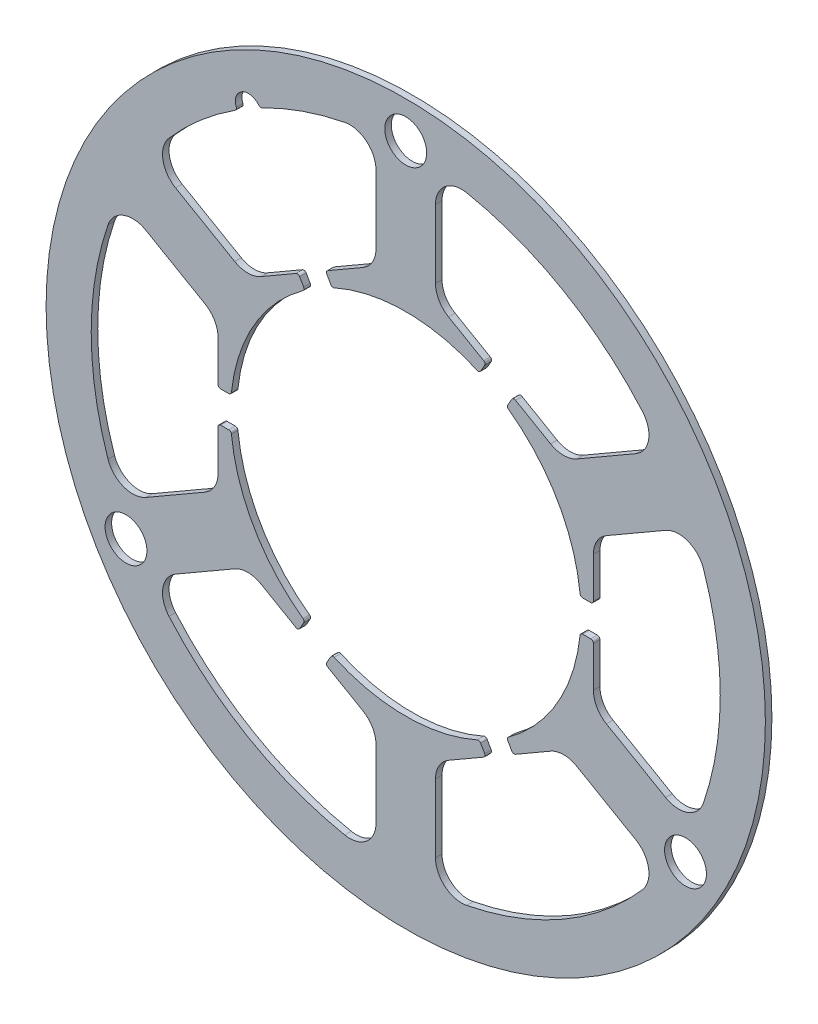
from build123d import *

# Parameters (mm, degrees)
IZIM1_R                     = 27.5
IZIM1_R_2                   = 1.6
Y_KSEKLIK_EKSTR_ZYON1_DEPTH = 0.5


with BuildPart() as part:
    # Çizim1 → Yükseklik-Ekstrüzyon1 (new body)
    with BuildSketch(Plane.XY):
        Circle(IZIM1_R)
        with Locations((0, 24.7)):
            Circle(IZIM1_R_2, mode=Mode.SUBTRACT)
        with Locations((21.390827473, -12.35)):
            Circle(IZIM1_R_2, mode=Mode.SUBTRACT)
        with Locations((-21.390827473, -12.35)):
            Circle(IZIM1_R_2, mode=Mode.SUBTRACT)
        with BuildLine():
            Line((5.962544219, 13.127476216), (3.275, 14.679130594))
            ThreePointArc((3.275, 14.679130594), (2.542949192, 15.411181402), (2.275, 16.411181402))
            Line((2.275, 16.411181402), (2.275, 21.631617485))
            ThreePointArc((2.275, 21.631617485), (3.00525794, 23.176853746), (4.662755102, 23.593668957))
            ThreePointArc((4.662755102, 23.593668957), (12.025, 20.827910961), (18.101339134, 15.834898849))
            ThreePointArc((18.101339134, 15.834898849), (18.569115153, 14.191056594), (17.596030267, 12.786016536))
            Line((17.596030267, 12.786016536), (13.075, 10.175798494))
            ThreePointArc((13.075, 10.175798494), (12.075, 9.907849302), (11.075, 10.175798494))
            Line((11.075, 10.175798494), (8.387415349, 11.727476216))
            ThreePointArc((8.387415349, 11.727476216), (8.23565154, 11.747456301), (8.114210268, 11.654271135))
            Line((8.114210268, 11.654271135), (7.803086106, 11.115388278))
            ThreePointArc((7.803086106, 11.115388278), (7.780694945, 10.973649682), (7.858992787, 10.853397274))
            ThreePointArc((7.858992787, 10.853397274), (11.604740184, 6.700000393), (13.328814056, 1.379389668))
            ThreePointArc((13.328814056, 1.379389668), (13.393806779, 1.251455553), (13.527751579, 1.199977574))
            Line((13.527751579, 1.199977574), (14.15, 1.199977574))
            ThreePointArc((14.15, 1.199977574), (14.291421356, 1.258556218), (14.35, 1.399977574))
            Line((14.35, 1.399977574), (14.35, 4.5033321))
            ThreePointArc((14.35, 4.5033321), (14.617949192, 5.5033321), (15.35, 6.235382907))
            Line((15.35, 6.235382907), (19.871030267, 8.845600949))
            ThreePointArc((19.871030267, 8.845600949), (21.574373094, 8.985797151), (22.764094236, 7.758770109))
            ThreePointArc((22.764094236, 7.758770109), (24.05, 0), (22.764094236, -7.758770109))
            ThreePointArc((22.764094236, -7.758770109), (21.574373094, -8.985797151), (19.871030267, -8.845600949))
            Line((19.871030267, -8.845600949), (15.35, -6.235382907))
            ThreePointArc((15.35, -6.235382907), (14.617949192, -5.5033321), (14.35, -4.5033321))
            Line((14.35, -4.5033321), (14.35, -1.400022426))
            ThreePointArc((14.35, -1.400022426), (14.291421356, -1.25860107), (14.15, -1.200022426))
            Line((14.15, -1.200022426), (13.527746938, -1.200022426))
            ThreePointArc((13.527746938, -1.200022426), (13.393802384, -1.251500184), (13.328809483, -1.379433861))
            ThreePointArc((13.328809483, -1.379433861), (11.604705706, -6.700060111), (7.85891707, -10.8534521))
            ThreePointArc((7.85891707, -10.8534521), (7.780618244, -10.973704644), (7.803009259, -11.115443923))
            Line((7.803009259, -11.115443923), (8.114128538, -11.654318322))
            ThreePointArc((8.114128538, -11.654318322), (8.23556981, -11.747503487), (8.387333619, -11.727523403))
            Line((8.387333619, -11.727523403), (11.075, -10.175798494))
            ThreePointArc((11.075, -10.175798494), (12.075, -9.907849302), (13.075, -10.175798494))
            Line((13.075, -10.175798494), (17.596030267, -12.786016536))
            ThreePointArc((17.596030267, -12.786016536), (18.569115153, -14.191056594), (18.101339134, -15.834898849))
            ThreePointArc((18.101339134, -15.834898849), (12.025, -20.827910961), (4.662755102, -23.593668957))
            ThreePointArc((4.662755102, -23.593668957), (3.00525794, -23.176853746), (2.275, -21.631617485))
            Line((2.275, -21.631617485), (2.275, -16.411181402))
            ThreePointArc((2.275, -16.411181402), (2.542949192, -15.411181402), (3.275, -14.679130594))
            Line((3.275, -14.679130594), (5.962462489, -13.127523403))
            ThreePointArc((5.962462489, -13.127523403), (6.055647654, -13.006082131), (6.035667569, -12.854318322))
            Line((6.035667569, -12.854318322), (5.724536107, -12.315422822))
            ThreePointArc((5.724536107, -12.315422822), (5.612983454, -12.225162531), (5.469693805, -12.232843074))
            ThreePointArc((5.469693805, -12.232843074), (-0.000141133, -13.399999999), (-5.469951483, -12.232727855))
            ThreePointArc((-5.469951483, -12.232727855), (-5.613242975, -12.225044943), (-5.724797631, -12.315305882))
            Line((-5.724797631, -12.315305882), (-6.035914348, -12.854175844))
            ThreePointArc((-6.035914348, -12.854175844), (-6.055894433, -13.005939653), (-5.962709268, -13.127380925))
            Line((-5.962709268, -13.127380925), (-3.275, -14.679130594))
            ThreePointArc((-3.275, -14.679130594), (-2.542949192, -15.411181402), (-2.275, -16.411181402))
            Line((-2.275, -16.411181402), (-2.275, -21.631617485))
            ThreePointArc((-2.275, -21.631617485), (-3.00525794, -23.176853746), (-4.662755102, -23.593668957))
            ThreePointArc((-4.662755102, -23.593668957), (-12.025, -20.827910961), (-18.101339134, -15.834898849))
            ThreePointArc((-18.101339134, -15.834898849), (-18.569115153, -14.191056594), (-17.596030267, -12.786016536))
            Line((-17.596030267, -12.786016536), (-13.075, -10.175798494))
            ThreePointArc((-13.075, -10.175798494), (-12.075, -9.907849302), (-11.075, -10.175798494))
            Line((-11.075, -10.175798494), (-8.387580398, -11.727380925))
            ThreePointArc((-8.387580398, -11.727380925), (-8.235816589, -11.747361009), (-8.114375318, -11.654175844))
            Line((-8.114375318, -11.654175844), (-7.803241292, -11.115275905))
            ThreePointArc((-7.803241292, -11.115275905), (-7.780849838, -10.973538687), (-7.859145691, -10.853286553))
            ThreePointArc((-7.859145691, -10.853286553), (-11.604811905, -6.699876166), (-13.328824155, -1.379292082))
            ThreePointArc((-13.328824155, -1.379292082), (-13.393816485, -1.251357001), (-13.527761829, -1.199878531))
            Line((-13.527761829, -1.199878531), (-14.15, -1.199878531))
            ThreePointArc((-14.15, -1.199878531), (-14.291421356, -1.258457175), (-14.35, -1.399878531))
            Line((-14.35, -1.399878531), (-14.35, -4.5033321))
            ThreePointArc((-14.35, -4.5033321), (-14.617949192, -5.5033321), (-15.35, -6.235382907))
            Line((-15.35, -6.235382907), (-19.871030267, -8.845600949))
            ThreePointArc((-19.871030267, -8.845600949), (-21.574373094, -8.985797151), (-22.764094236, -7.758770109))
            ThreePointArc((-22.764094236, -7.758770109), (-24.05, 0), (-22.764094236, 7.758770109))
            ThreePointArc((-22.764094236, 7.758770109), (-21.574373094, 8.985797151), (-19.871030267, 8.845600949))
            Line((-19.871030267, 8.845600949), (-15.35, 6.235382907))
            ThreePointArc((-15.35, 6.235382907), (-14.617949192, 5.5033321), (-14.35, 4.5033321))
            Line((-14.35, 4.5033321), (-14.35, 1.400121469))
            ThreePointArc((-14.35, 1.400121469), (-14.291421356, 1.258700113), (-14.15, 1.200121469))
            Line((-14.15, 1.200121469), (-13.527736687, 1.200121469))
            ThreePointArc((-13.527736687, 1.200121469), (-13.393792677, 1.251598736), (-13.328799383, 1.379531447))
            ThreePointArc((-13.328799383, 1.379531447), (-11.604703847, 6.700063329), (-7.858990512, 10.85339892))
            ThreePointArc((-7.858990512, 10.85339892), (-7.780692641, 10.973651333), (-7.803083798, 11.115389949))
            Line((-7.803083798, 11.115389949), (-8.114207814, 11.654272553))
            ThreePointArc((-8.114207814, 11.654272553), (-8.235649086, 11.747457718), (-8.387412895, 11.727477633))
            Line((-8.387412895, 11.727477633), (-11.075, 10.175798494))
            ThreePointArc((-11.075, 10.175798494), (-12.075, 9.907849302), (-13.075, 10.175798494))
            Line((-13.075, 10.175798494), (-17.596030267, 12.786016536))
            ThreePointArc((-17.596030267, 12.786016536), (-18.569115153, 14.191056594), (-18.101339134, 15.834898849))
            ThreePointArc((-18.101339134, 15.834898849), (-15.719264288, 18.201846891), (-13.030721544, 20.213925795))
            ThreePointArc((-13.030721544, 20.213925795), (-12.948542196, 20.32125171), (-12.953404277, 20.456339302))
            ThreePointArc((-12.953404277, 20.456339302), (-12.525, 21.693936365), (-11.239007365, 21.44614682))
            ThreePointArc((-11.239007365, 21.44614682), (-11.12444912, 21.374392338), (-10.990412477, 21.391898784))
            ThreePointArc((-10.990412477, 21.391898784), (-7.903629659, 22.714205648), (-4.662755102, 23.593668957))
            ThreePointArc((-4.662755102, 23.593668957), (-3.00525794, 23.176853746), (-2.275, 21.631617485))
            Line((-2.275, 21.631617485), (-2.275, 16.411181402))
            ThreePointArc((-2.275, 16.411181402), (-2.542949192, 15.411181402), (-3.275, 14.679130594))
            Line((-3.275, 14.679130594), (-5.962541764, 13.127477633))
            ThreePointArc((-5.962541764, 13.127477633), (-6.055726929, 13.006036362), (-6.035746845, 12.854272553))
            Line((-6.035746845, 12.854272553), (-5.724620119, 12.315385257))
            ThreePointArc((-5.724620119, 12.315385257), (-5.613066823, 12.225124758), (-5.469776582, 12.232806062))
            ThreePointArc((-5.469776582, 12.232806062), (1.404e-06, 13.4), (5.469779145, 12.232804916))
            ThreePointArc((5.469779145, 12.232804916), (5.613069404, 12.225123588), (5.724622721, 12.315384093))
            Line((5.724622721, 12.315384093), (6.035749299, 12.854271135))
            ThreePointArc((6.035749299, 12.854271135), (6.055729384, 13.006034944), (5.962544219, 13.127476216))
        make_face(mode=Mode.SUBTRACT)
    extrude(amount=Y_KSEKLIK_EKSTR_ZYON1_DEPTH)


solid = part.part
